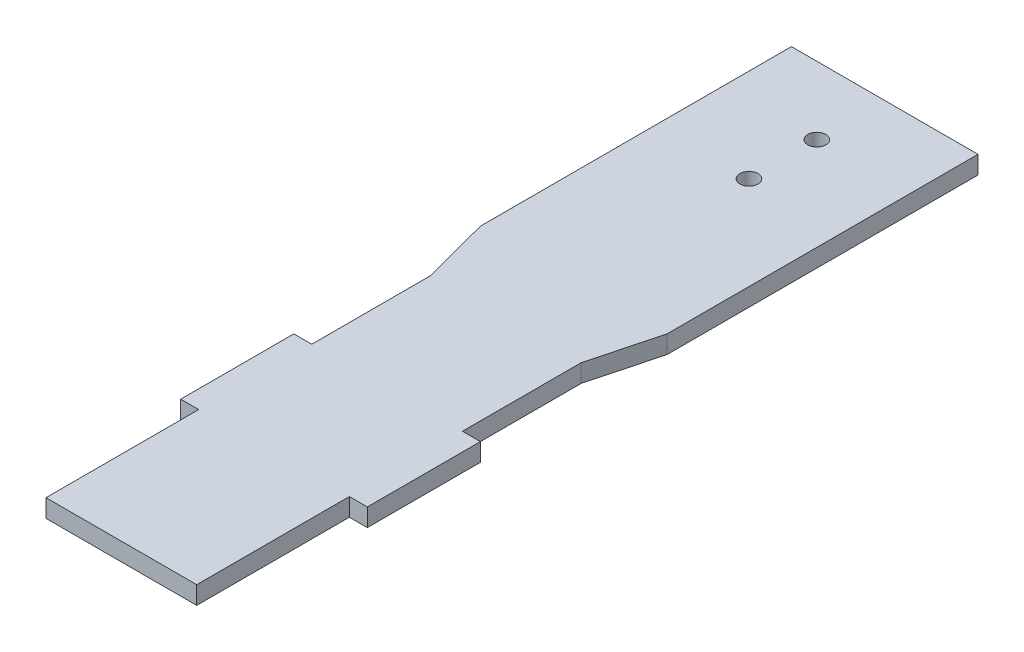
from build123d import *

# Parameters (mm, degrees)
BOSS_EXTRUDE1_DEPTH     = 3.175
CUT_EXTRUDE1_DEPTH      = 137.041650332
CUT_EXTRUDE1_DEPTH_BACK = 137.041650332
SKETCH2_R               = 1.6


with BuildPart() as part:
    # Sketch1 → Boss-Extrude1 (new body)
    with BuildSketch(Plane(origin=(0, 0, 0), x_dir=(1, 0, 0), z_dir=(0, 1, 0))):
        Polygon((-16.5, 0), (16.5, 0), (16.5, -55), (13.325, -67), (13.325, -88), (16.5, -88), (16.5, -108), (13.325, -108), (13.325, -135), (-13.325, -135), (-13.325, -108), (-16.5, -108), (-16.5, -88), (-13.325, -88), (-13.325, -67), (-16.5, -55), align=None)
    extrude(amount=BOSS_EXTRUDE1_DEPTH)

    # Sketch2 → Cut-Extrude1 (cut, two sides: drawn at the far end of the back side and taken through both)
    with BuildSketch(Plane(origin=(0, 3.175, 0), x_dir=(1, 0, 0), z_dir=(0, 1, 0)).offset(-CUT_EXTRUDE1_DEPTH_BACK)):
        with Locations((0, -24)):
            Circle(SKETCH2_R)
        with Locations((0, -12)):
            Circle(SKETCH2_R)
    extrude(amount=CUT_EXTRUDE1_DEPTH + CUT_EXTRUDE1_DEPTH_BACK, mode=Mode.SUBTRACT)


solid = part.part
